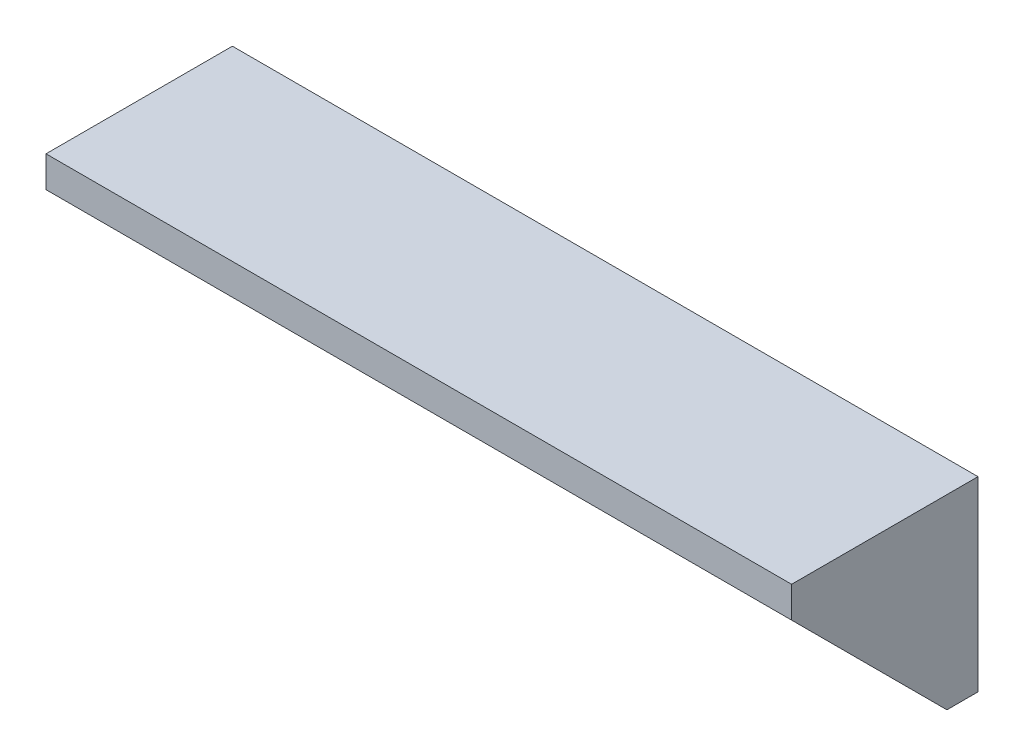
from build123d import *

# Parameters (mm, degrees)
SKETCH1_W           = 120
SKETCH1_H           = 30
SKETCH1_R           = 1.7
BOSS_EXTRUDE1_DEPTH = 30
SKETCH3_R           = 3
CUT_EXTRUDE1_DEPTH  = 30
CHAMFER1_SIZE       = 25


with BuildPart() as part:
    # Sketch1 → Boss-Extrude1 (new body)
    with BuildSketch(Plane.XY):
        Rectangle(SKETCH1_W, SKETCH1_H)
        with Locations((-40, 0)):
            Circle(SKETCH1_R, mode=Mode.SUBTRACT)
        with Locations((40, 0)):
            Circle(SKETCH1_R, mode=Mode.SUBTRACT)
    extrude(amount=-BOSS_EXTRUDE1_DEPTH)

    # Sketch3 → Cut-Extrude1 (cut)
    with BuildSketch(Plane(origin=(0, 0, -25), x_dir=(-1, 0, 0), z_dir=(0, 0, -1))):
        with Locations((-40, 0)):
            Circle(SKETCH3_R)
        with Locations((40, 0)):
            Circle(SKETCH3_R)
    extrude(amount=-CUT_EXTRUDE1_DEPTH, mode=Mode.SUBTRACT)

    # Chamfer1
    # the kernel refuses this chamfer: 25 mm, written as the material it takes off along each edge
    with BuildSketch(Plane(origin=(124.292074699, -15, 0), x_dir=(0, 0.9996219169112966, 0.02749587661058637), z_dir=(-1, 0, 0))) as chamfer1_piece_1:
        Polygon((CHAMFER1_SIZE * 0.999621916911, CHAMFER1_SIZE * 0.0274958766106), (-CHAMFER1_SIZE * 0.0274958766106, CHAMFER1_SIZE * 0.999621916911), (0, 0), align=None)
    extrude(amount=248.584149398, mode=Mode.SUBTRACT)


solid = part.part
